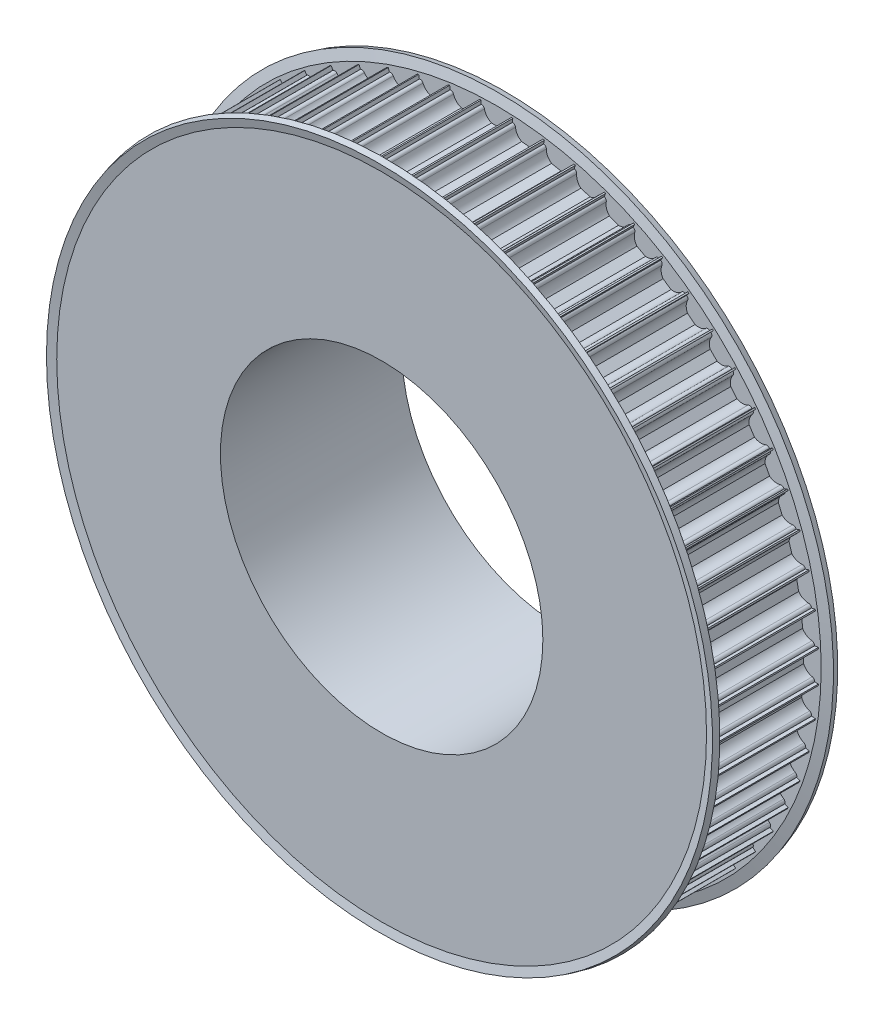
from build123d import *

# Parameters (mm, degrees)
CUT_EXTRUDE1_REACH = 123.758
CIRPATTERN1_COUNT  = 64


with BuildPart() as part:
    # Sketch1 → Revolve1 (revolve)
    with BuildSketch(Plane(origin=(0, 0, 0), x_dir=(0, 0, -1), z_dir=(1, 0, 0))):
        Polygon((-5, 40), (40, 40), (40, 55.5), (25, 55.5), (25, 80), (-5, 80), align=None)
    revolve(axis=Axis((0, 0, 0), (0, 0, -1)))

    # Sketch2 → Cut-Extrude1 (cut, up to next)
    with BuildSketch(Plane.XY.offset(5), mode=Mode.PRIVATE) as cut_extrude1_sk1:
        with BuildLine():
            Line((-3.674234614, 79), (-3.75, 79))
            Line((-3.75, 79), (-3.75, 81))
            Line((-3.75, 81), (3.75, 81))
            Line((3.75, 81), (3.75, 79))
            Line((3.75, 79), (3.674234614, 79))
            ThreePointArc((3.674234614, 79), (3.199892965, 78.830947502), (2.939387691, 78.4))
            ThreePointArc((2.939387691, 78.4), (2.331759211, 77.112435701), (1.198957881, 76.25))
            Line((1.198957881, 76.25), (-1.198957881, 76.25))
            ThreePointArc((-1.198957881, 76.25), (-2.331759211, 77.112435701), (-2.939387691, 78.4))
            ThreePointArc((-2.939387691, 78.4), (-3.199892965, 78.830947502), (-3.674234614, 79))
        make_face()
    cut_extrude1_tool1 = extrude(cut_extrude1_sk1.sketch, amount=-CUT_EXTRUDE1_REACH, mode=Mode.PRIVATE) & part.part
    cut_extrude1 = cut_extrude1_tool1.solids().sort_by_distance((0, 78.935169, 5))[0]
    add(cut_extrude1, mode=Mode.SUBTRACT)

    # CirPattern1: Cut-Extrude1 ×64 about axis
    cirpattern1_axis = Axis((0, 0, 5), (0, 0, 1))
    for i in range(1, CIRPATTERN1_COUNT):
        add(cut_extrude1.rotate(cirpattern1_axis, i * 360 / CIRPATTERN1_COUNT), mode=Mode.SUBTRACT)

    # Sketch3 → Revolve2 (revolve)
    with BuildSketch(Plane(origin=(0, 0, 0), x_dir=(0, 0, -1), z_dir=(1, 0, 0))):
        Polygon((25, 80.61), (25.539052531, 82.621771432), (24.090163791, 83.01), (23.447085729, 80.61), (23.447085729, 55.5), (25, 55.5), align=None)
        Polygon((-5, 80.61), (-5.539052531, 82.621771432), (-4.090163791, 83.01), (-3.447085729, 80.61), (-3.447085729, 55.5), (-5, 55.5), align=None)
    revolve(axis=Axis((0, 0, 0), (0, 0, 1)))


solid = part.part
